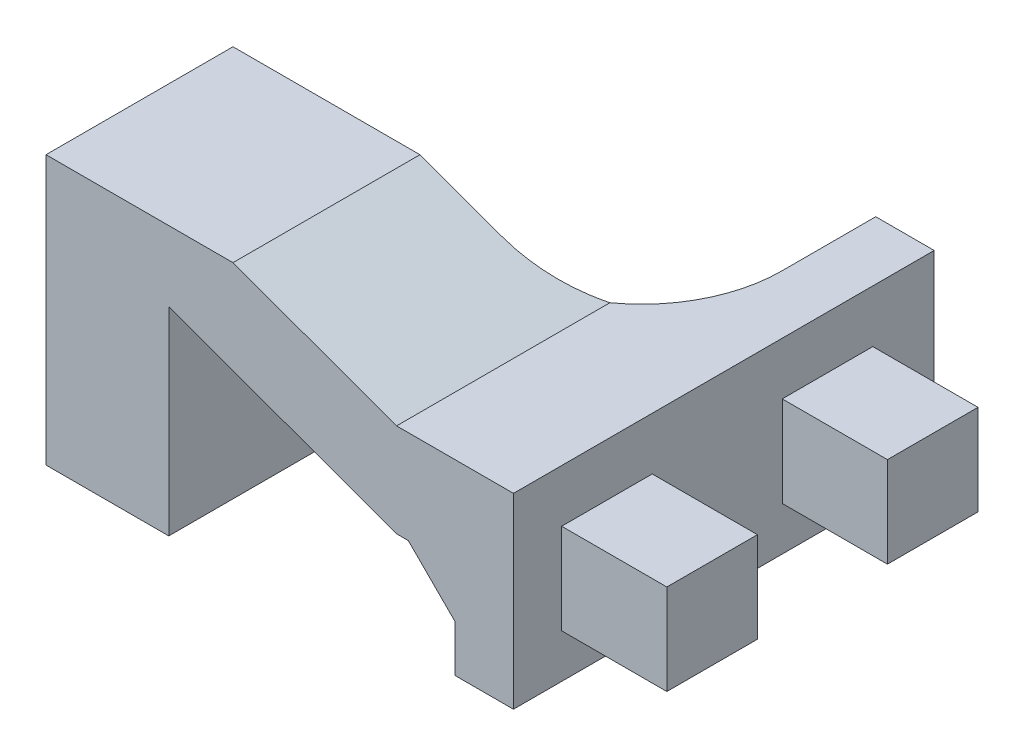
from build123d import *

# Parameters (mm, degrees)
SKETCH1_W           = 5.252522581
SKETCH1_H           = 8.5
BOSS_EXTRUDE1_DEPTH = 4
BOSS_EXTRUDE4_DEPTH = 14
SKETCH1_3_W         = 4.5
SKETCH1_3_H         = 3.875
BOSS_EXTRUDE2_DEPTH = 1.9375
BOSS_EXTRUDE5_START = -11.375
SKETCH1_8_W         = 4.5
SKETCH1_8_H         = 3.875
BOSS_EXTRUDE5_DEPTH = 3.875
FILLET1_R           = 6


with BuildPart() as part:
    # Sketch1 → Boss-Extrude1 (new, symmetric)
    with BuildSketch(Plane.XY):
        Polygon((-5, 7.5), (-4.5, 7.5), (-2.5, 5.5), (-2.5, 3.5), (0, 3.5), (0, 11.5), (-5, 11.5), align=None)
        Polygon((-20, 11.04779164), (-14.747477419, 11.04779164), (-5, 7.5), (-5, 11.5), (-12, 14.04779164), (-20, 14.04779164), align=None)
        with Locations((-17.373738709, 6.79779164)):
            Rectangle(SKETCH1_W, SKETCH1_H)
    extrude(amount=BOSS_EXTRUDE1_DEPTH, both=True)

    # Sketch1<7> → Boss-Extrude4 (add)
    with BuildSketch(Plane.XY):
        Polygon((-2.5, 3.5), (0, 3.5), (0, 5.375), (0, 9.25), (0, 11.5), (-2.5, 11.5), (-2.5, 5.5), align=None)
    extrude(amount=-BOSS_EXTRUDE4_DEPTH)

    # Sketch1<3> → Boss-Extrude2 (add, symmetric)
    with BuildSketch(Plane.XY):
        with Locations((2.25, 7.3125)):
            Rectangle(SKETCH1_3_W, SKETCH1_3_H)
    extrude(amount=BOSS_EXTRUDE2_DEPTH, both=True)

    # Sketch1<8> → Boss-Extrude5 (add)
    with BuildSketch(Plane.XY.offset(BOSS_EXTRUDE5_START)):
        with Locations((2.25, 7.3125)):
            Rectangle(SKETCH1_8_W, SKETCH1_8_H)
    extrude(amount=BOSS_EXTRUDE5_DEPTH)

    # Fillet1
    # the kernel refuses this fillet: 6 mm, written as the material it adds along each edge
    with BuildSketch(Plane(origin=(-2.5, 11.5, -4), x_dir=(-1, 0, 0), z_dir=(0, -1, 0))) as fillet1_piece_1_section:
        with BuildLine():
            CenterArc((FILLET1_R, FILLET1_R), FILLET1_R, 180, 90)
            Line((0, FILLET1_R), (0, 0))
            Line((0, 0), (FILLET1_R, 0))
        make_face()
    fillet1_piece_1 = extrude(amount=21, mode=Mode.PRIVATE)
    fillet1_piece_1 = split(fillet1_piece_1, bisect_by=Plane(origin=(-3.153811187, 10.828042225, -5.911199104), z_dir=(0.3420201433256695, 0.9396926207859081, 0)), keep=Keep.TOP, mode=Mode.PRIVATE)
    add(fillet1_piece_1)
    with BuildSketch(Plane(origin=(-2.5, 26.5, -4), x_dir=(-1, 0, 0), z_dir=(0, -1, 0))) as fillet1_piece_2_section:
        with BuildLine():
            CenterArc((FILLET1_R, FILLET1_R), FILLET1_R, 180, 90)
            Line((0, FILLET1_R), (0, 0))
            Line((0, 0), (FILLET1_R, 0))
        make_face()
    fillet1_piece_2 = extrude(amount=36, mode=Mode.PRIVATE)
    fillet1_piece_2 = split(fillet1_piece_2, bisect_by=Plane(origin=(-6.665111155, 12.106050897, -4.105232665), z_dir=(-0.3420201433256695, -0.9396926207859081, 0)), keep=Keep.TOP, mode=Mode.PRIVATE)
    fillet1_piece_2 = split(fillet1_piece_2, bisect_by=Plane(origin=(-6.768551784, 11.5, -4.105232665), z_dir=(0, 1, 0)), keep=Keep.TOP, mode=Mode.PRIVATE)
    add(fillet1_piece_2)
    with BuildSketch(Plane(origin=(-2.5, 11.5, -4), x_dir=(-1, 0, 0), z_dir=(0, -1, 0))) as fillet1_piece_3_section:
        with BuildLine():
            CenterArc((FILLET1_R, FILLET1_R), FILLET1_R, 180, 90)
            Line((0, FILLET1_R), (0, 0))
            Line((0, 0), (FILLET1_R, 0))
        make_face()
    fillet1_piece_3 = extrude(amount=21, mode=Mode.PRIVATE)
    fillet1_piece_3 = split(fillet1_piece_3, bisect_by=Plane(origin=(-3.734199971, 7.5, -5.388361027), z_dir=(0, 1, 0)), keep=Keep.TOP, mode=Mode.PRIVATE)
    fillet1_piece_3 = split(fillet1_piece_3, bisect_by=Plane(origin=(-3.190866328, 10.841529194, -5.388361027), z_dir=(-0.3420201433256695, -0.9396926207859081, 0)), keep=Keep.TOP, mode=Mode.PRIVATE)
    fillet1_piece_3 = split(fillet1_piece_3, bisect_by=Plane(origin=(-5.041466125, 8.041466125, -5.388361027), z_dir=(0.7071067811865476, 0.7071067811865476, 0)), keep=Keep.TOP, mode=Mode.PRIVATE)
    add(fillet1_piece_3)
    with BuildSketch(Plane(origin=(-2.5, 11.5, -4), x_dir=(-1, 0, 0), z_dir=(0, -1, 0))) as fillet1_piece_4_section:
        with BuildLine():
            CenterArc((FILLET1_R, FILLET1_R), FILLET1_R, 180, 90)
            Line((0, FILLET1_R), (0, 0))
            Line((0, 0), (FILLET1_R, 0))
        make_face()
    fillet1_piece_4 = extrude(amount=21, mode=Mode.PRIVATE)
    fillet1_piece_4 = split(fillet1_piece_4, bisect_by=Plane(origin=(-2.999537912, 7.5, -5.943273976), z_dir=(0, -1, 0)), keep=Keep.TOP, mode=Mode.PRIVATE)
    fillet1_piece_4 = split(fillet1_piece_4, bisect_by=Plane(origin=(-3.116705646, 6.814536913, -5.943273976), z_dir=(0.3420201433256692, 0.9396926207859082, 0)), keep=Keep.TOP, mode=Mode.PRIVATE)
    fillet1_piece_4 = split(fillet1_piece_4, bisect_by=Plane(origin=(-3.567995264, 6.567995264, -5.943273976), z_dir=(0.7071067811865476, 0.7071067811865476, 0)), keep=Keep.TOP, mode=Mode.PRIVATE)
    add(fillet1_piece_4)
    with BuildSketch(Plane(origin=(-2.5, 11.5, -4), x_dir=(-1, 0, 0), z_dir=(0, -1, 0))) as fillet1_piece_5_section:
        with BuildLine():
            CenterArc((FILLET1_R, FILLET1_R), FILLET1_R, 180, 90)
            Line((0, FILLET1_R), (0, 0))
            Line((0, 0), (FILLET1_R, 0))
        make_face()
    fillet1_piece_5 = extrude(amount=21, mode=Mode.PRIVATE)
    fillet1_piece_5 = split(fillet1_piece_5, bisect_by=Plane(origin=(-6.347942504, 7.5, -4.191885591), z_dir=(0, 1, 0)), keep=Keep.TOP, mode=Mode.PRIVATE)
    fillet1_piece_5 = split(fillet1_piece_5, bisect_by=Plane(origin=(-6.566870253, 8.070294133, -4.191885591), z_dir=(0.3420201433256692, 0.9396926207859082, 0)), keep=Keep.TOP, mode=Mode.PRIVATE)
    fillet1_piece_5 = split(fillet1_piece_5, bisect_by=Plane(origin=(-6.009867842, 9.009867842, -4.191885591), z_dir=(-0.7071067811865476, -0.7071067811865476, 0)), keep=Keep.TOP, mode=Mode.PRIVATE)
    add(fillet1_piece_5)
    with BuildSketch(Plane(origin=(-2.5, 11.5, -4), x_dir=(-1, 0, 0), z_dir=(0, -1, 0))) as fillet1_piece_6_section:
        with BuildLine():
            CenterArc((FILLET1_R, FILLET1_R), FILLET1_R, 180, 90)
            Line((0, FILLET1_R), (0, 0))
            Line((0, 0), (FILLET1_R, 0))
        make_face()
    fillet1_piece_6 = extrude(amount=21, mode=Mode.PRIVATE)
    fillet1_piece_6 = split(fillet1_piece_6, bisect_by=Plane(origin=(-2.735586813, 6.675821002, -6.085139246), z_dir=(-0.3420201433256692, -0.9396926207859082, 0)), keep=Keep.TOP, mode=Mode.PRIVATE)
    fillet1_piece_6 = split(fillet1_piece_6, bisect_by=Plane(origin=(-3.085930182, 6.085930182, -6.085139246), z_dir=(0.7071067811865476, 0.7071067811865476, 0)), keep=Keep.TOP, mode=Mode.PRIVATE)
    add(fillet1_piece_6)


solid = part.part
